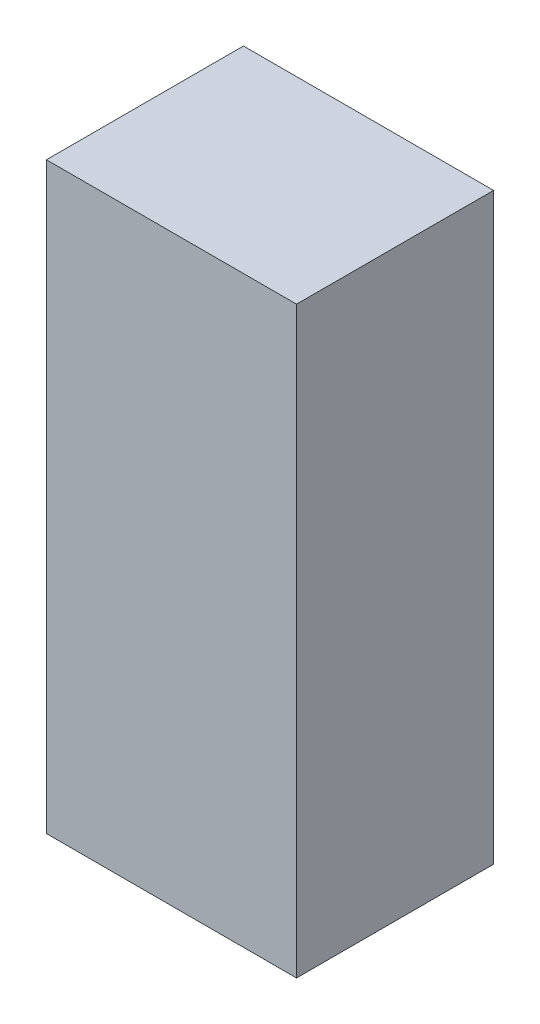
from build123d import *

# Parameters (mm, degrees)
SKETCH1_W           = 77
SKETCH1_H           = 33
BOSS_EXTRUDE1_DEPTH = 26


with BuildPart() as part:
    # Sketch1 → Boss-Extrude1 (new body)
    with BuildSketch(Plane(origin=(0, 0, 0), x_dir=(0, 1, 0), z_dir=(0, 0, 1))):
        with Locations((38.5, 16.5)):
            Rectangle(SKETCH1_W, SKETCH1_H)
    extrude(amount=BOSS_EXTRUDE1_DEPTH)


solid = part.part
